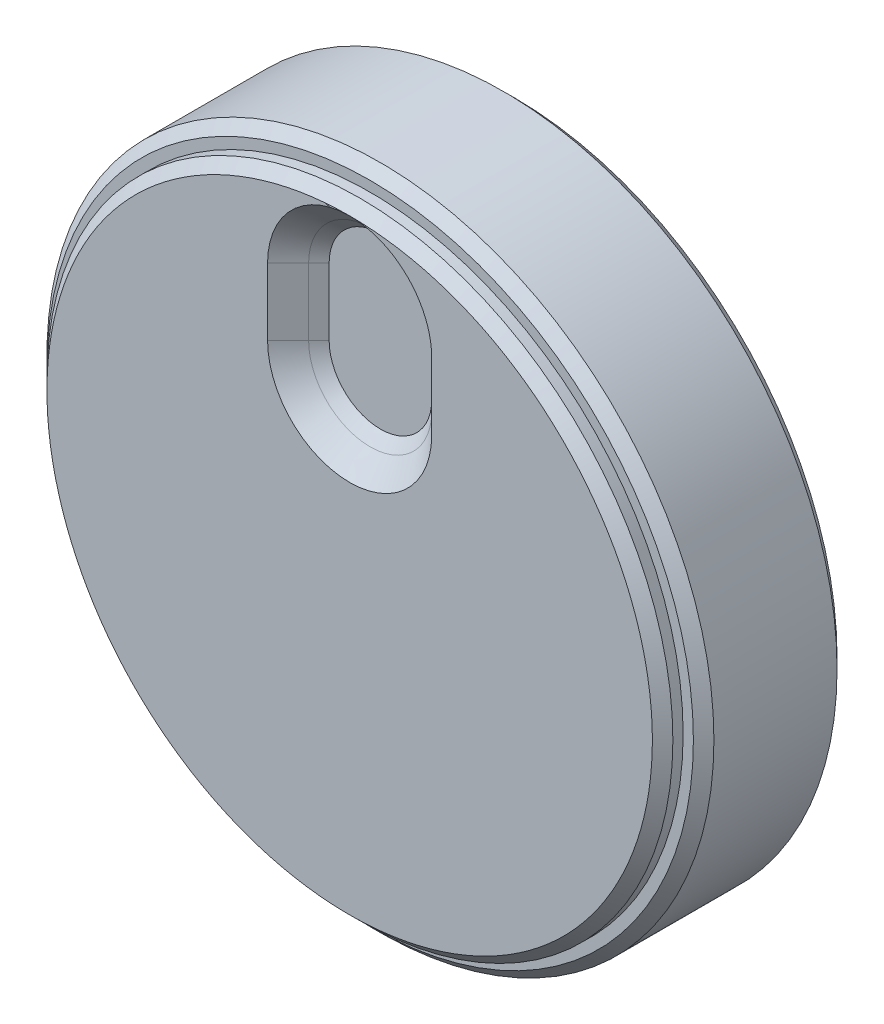
from build123d import *

# Parameters (mm, degrees)
CROQUIS1_R              = 32.5
CROQUIS1_R_2            = 3
SALIENTE_EXTRUIR1_DEPTH = 14
CROQUIS2_R              = 17.5
CORTAR_EXTRUIR1_DEPTH   = 3
CROQUIS3_R              = 30.5
SALIENTE_EXTRUIR2_DEPTH = 2
CHAFL_N1_SIZE           = 1
CORTAR_EXTRUIR2_DEPTH   = 3
CHAFL_N2_SIZE           = 2
SALIENTE_EXTRUIR3_START = 1
SALIENTE_EXTRUIR3_DEPTH = 1
CHAFL_N3_SIZE           = 1


with BuildPart() as part:
    # Croquis1 → Saliente-Extruir1 (new body)
    with BuildSketch(Plane.XY):
        Circle(CROQUIS1_R)
        Circle(CROQUIS1_R_2, mode=Mode.SUBTRACT)
    extrude(amount=SALIENTE_EXTRUIR1_DEPTH)

    # Croquis2 → Cortar-Extruir1 (cut)
    with BuildSketch(Plane(origin=(0, 0, 0), x_dir=(-1, 0, 0), z_dir=(0, 0, -1))):
        Circle(CROQUIS2_R)
    extrude(amount=-CORTAR_EXTRUIR1_DEPTH, mode=Mode.SUBTRACT)

    # Croquis3 → Saliente-Extruir2 (add)
    with BuildSketch(Plane.XY.offset(14)):
        Circle(CROQUIS3_R)
    extrude(amount=SALIENTE_EXTRUIR2_DEPTH)

    # Chaflán1
    chafl_n1_edges = [part.edges().sort_by_distance(p)[0] for p in [
        (-30.5, 0, 16),
        (-32.5, 0, 0),
        (-32.5, 0, 14),
    ]]
    chamfer(chafl_n1_edges, length=CHAFL_N1_SIZE)

    # Croquis4 → Cortar-Extruir2 (cut)
    with BuildSketch(Plane.XY.offset(16)):
        with BuildLine():
            Line((6, 21.5), (6, 15))
            ThreePointArc((6, 15), (0, 9), (-6, 15))
            Line((-6, 15), (-6, 21.5))
            ThreePointArc((-6, 21.5), (0, 27.5), (6, 21.5))
        make_face()
    extrude(amount=-CORTAR_EXTRUIR2_DEPTH, mode=Mode.SUBTRACT)

    # Chaflán2
    chafl_n2_edges = [part.edges().sort_by_distance(p)[0] for p in [
        (0, 27.5, 16),
        (-6, 18.25, 16),
        (0, 9, 16),
        (6, 18.25, 16),
    ]]
    chamfer(chafl_n2_edges, length=CHAFL_N2_SIZE - 0.0001)  # a hair under: the kernel refuses the full size

    # Croquis5 → Saliente-Extruir3 (add)
    with BuildSketch(Plane.XY.offset(13).offset(SALIENTE_EXTRUIR3_START)):
        with BuildLine():
            Line((-6, 21.5), (-6, 15))
            ThreePointArc((-6, 15), (0, 9), (6, 15))
            Line((6, 15), (6, 21.5))
            ThreePointArc((6, 21.5), (0, 27.5), (-6, 21.5))
        make_face()
        with BuildLine():
            Line((5, 15), (5, 21.5))
            ThreePointArc((5, 21.5), (0, 26.5), (-5, 21.5))
            Line((-5, 21.5), (-5, 15))
            ThreePointArc((-5, 15), (0, 10), (5, 15))
        make_face(mode=Mode.SUBTRACT)
    extrude(amount=-SALIENTE_EXTRUIR3_DEPTH)

    # Chaflán3
    chafl_n3_edges = [part.edges().sort_by_distance(p)[0] for p in [
        (5, 18.25, 14),
        (0, 26.5, 14),
        (0, 10, 14),
        (-5, 18.25, 14),
    ]]
    chamfer(chafl_n3_edges, length=CHAFL_N3_SIZE - 0.0001)  # a hair under: the kernel refuses the full size


solid = part.part
